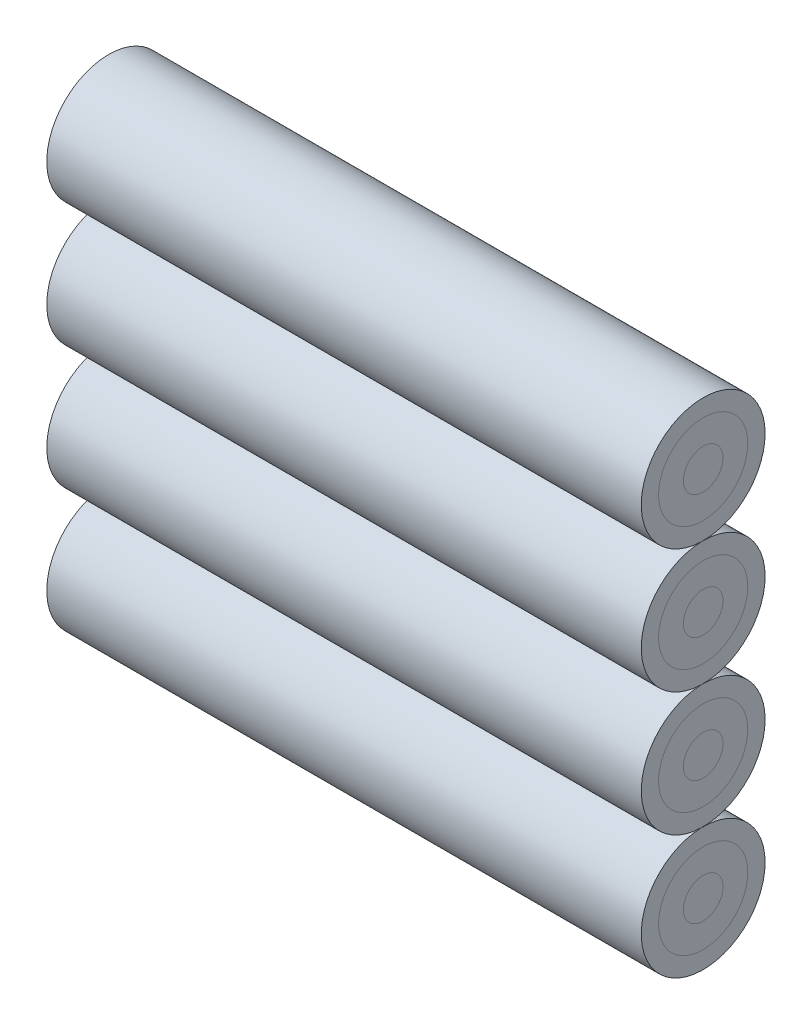
from build123d import *

# Parameters (mm, degrees)
SKETCH_1_R          = 125
EXTRUDE_1_DEPTH     = 1200
EXTRUDE_1_2_DEPTH   = 1200
EXTRUDE_1_3_DEPTH   = 1200
EXTRUDE_1_4_DEPTH   = 1200
SKETCH_2_R          = 90
CUT_EXTRUDE_1_DEPTH = 1306.995788661
SKETCH_3_R          = 90
EXTRUDE_3_DEPTH     = 1200
EXTRUDE_3_2_DEPTH   = 1200
EXTRUDE_3_3_DEPTH   = 1200
EXTRUDE_3_4_DEPTH   = 1200
SKETCH_4_R          = 40
CUT_EXTRUDE_2_DEPTH = 1306.995788661
SKETCH_5_R          = 40
EXTRUDE_7_DEPTH     = 1200
EXTRUDE_7_2_DEPTH   = 1200
EXTRUDE_7_3_DEPTH   = 1200
EXTRUDE_7_4_DEPTH   = 1200


with BuildPart() as part:
    # 草图1 → 凸台-拉伸1 (new body)
    with BuildSketch(Plane(origin=(0, 0, 0), x_dir=(0, 0, -1), z_dir=(1, 0, 0))):
        with Locations((0, 375)):
            Circle(SKETCH_1_R)
    extrude(amount=EXTRUDE_1_DEPTH)


with BuildPart() as body_2:
    # 草图1 → Extrude 1 2 (new body)
    with BuildSketch(Plane(origin=(0, 0, 0), x_dir=(0, 0, -1), z_dir=(1, 0, 0))):
        with Locations((0, -375)):
            Circle(SKETCH_1_R)
    extrude(amount=EXTRUDE_1_2_DEPTH)


with BuildPart() as body_3:
    # 草图1 → Extrude 1 3 (new body)
    with BuildSketch(Plane(origin=(0, 0, 0), x_dir=(0, 0, -1), z_dir=(1, 0, 0))):
        with BuildLine():
            ThreePointArc((-2.83e-07, -250), (125, -124.999999913), (-4.57e-07, 0))
            ThreePointArc((-4.57e-07, 0), (-125, -125.000000087), (-2.83e-07, -250))
        make_face()
    extrude(amount=EXTRUDE_1_3_DEPTH)


with BuildPart() as body_4:
    # 草图1 → Extrude 1 4 (new body)
    with BuildSketch(Plane(origin=(0, 0, 0), x_dir=(0, 0, -1), z_dir=(1, 0, 0))):
        with BuildLine():
            ThreePointArc((-4.57e-07, 0), (125, 124.999999913), (-2.83e-07, 250))
            ThreePointArc((-2.83e-07, 250), (-125, 125.000000087), (-4.57e-07, 0))
        make_face()
    extrude(amount=EXTRUDE_1_4_DEPTH)


with BuildPart() as cut_extrude_1_tool:
    # 草图2 → 切除-拉伸1 (new, through all)
    with BuildSketch(Plane(origin=(1200, 0, 0), x_dir=(0, 0, -1), z_dir=(1, 0, 0))):
        with Locations((0, 375)):
            Circle(SKETCH_2_R)
        with Locations((0, 125)):
            Circle(SKETCH_2_R)
        with Locations((0, -125)):
            Circle(SKETCH_2_R)
        with Locations((0, -375)):
            Circle(SKETCH_2_R)
    extrude(amount=-CUT_EXTRUDE_1_DEPTH)


with BuildPart() as part_1:
    add(part.part)

    # 切除-拉伸1: cut by cut_extrude_1_tool
    add(cut_extrude_1_tool.part, mode=Mode.SUBTRACT)


with BuildPart() as body_2_1:
    add(body_2.part)

    # 切除-拉伸1: cut by cut_extrude_1_tool
    add(cut_extrude_1_tool.part, mode=Mode.SUBTRACT)


with BuildPart() as body_3_1:
    add(body_3.part)

    # 切除-拉伸1: cut by cut_extrude_1_tool
    add(cut_extrude_1_tool.part, mode=Mode.SUBTRACT)


with BuildPart() as body_4_1:
    add(body_4.part)

    # 切除-拉伸1: cut by cut_extrude_1_tool
    add(cut_extrude_1_tool.part, mode=Mode.SUBTRACT)


with BuildPart() as body_5:
    # 草图3 → 凸台-拉伸3 (new body)
    with BuildSketch(Plane(origin=(0, 0, 0), x_dir=(0, 0, -1), z_dir=(1, 0, 0))):
        with Locations((0, 375)):
            Circle(SKETCH_3_R)
    extrude(amount=EXTRUDE_3_DEPTH)


with BuildPart() as body_6:
    # 草图3 → Extrude 3 2 (new body)
    with BuildSketch(Plane(origin=(0, 0, 0), x_dir=(0, 0, -1), z_dir=(1, 0, 0))):
        with Locations((0, 125)):
            Circle(SKETCH_3_R)
    extrude(amount=EXTRUDE_3_2_DEPTH)


with BuildPart() as body_7:
    # 草图3 → Extrude 3 3 (new body)
    with BuildSketch(Plane(origin=(0, 0, 0), x_dir=(0, 0, -1), z_dir=(1, 0, 0))):
        with Locations((0, -125)):
            Circle(SKETCH_3_R)
    extrude(amount=EXTRUDE_3_3_DEPTH)


with BuildPart() as body_8:
    # 草图3 → Extrude 3 4 (new body)
    with BuildSketch(Plane(origin=(0, 0, 0), x_dir=(0, 0, -1), z_dir=(1, 0, 0))):
        with Locations((0, -375)):
            Circle(SKETCH_3_R)
    extrude(amount=EXTRUDE_3_4_DEPTH)


with BuildPart() as cut_extrude_2_tool:
    # 草图4 → 切除-拉伸2 (new, through all)
    with BuildSketch(Plane(origin=(1200, 0, 0), x_dir=(0, 0, -1), z_dir=(1, 0, 0))):
        with Locations((0, 375)):
            Circle(SKETCH_4_R)
        with Locations((0, 125)):
            Circle(SKETCH_4_R)
        with Locations((0, -125)):
            Circle(SKETCH_4_R)
        with Locations((0, -375)):
            Circle(SKETCH_4_R)
    extrude(amount=-CUT_EXTRUDE_2_DEPTH)


with BuildPart() as body_5_1:
    add(body_5.part)

    # 切除-拉伸2: cut by cut_extrude_2_tool
    add(cut_extrude_2_tool.part, mode=Mode.SUBTRACT)


with BuildPart() as body_6_1:
    add(body_6.part)

    # 切除-拉伸2: cut by cut_extrude_2_tool
    add(cut_extrude_2_tool.part, mode=Mode.SUBTRACT)


with BuildPart() as body_7_1:
    add(body_7.part)

    # 切除-拉伸2: cut by cut_extrude_2_tool
    add(cut_extrude_2_tool.part, mode=Mode.SUBTRACT)


with BuildPart() as body_8_1:
    add(body_8.part)

    # 切除-拉伸2: cut by cut_extrude_2_tool
    add(cut_extrude_2_tool.part, mode=Mode.SUBTRACT)


with BuildPart() as body_9:
    # 草图5 → 凸台-拉伸7 (new body)
    with BuildSketch(Plane(origin=(0, 0, 0), x_dir=(0, 0, -1), z_dir=(1, 0, 0))):
        with Locations((0, 375)):
            Circle(SKETCH_5_R)
    extrude(amount=EXTRUDE_7_DEPTH)


with BuildPart() as body_10:
    # 草图5 → Extrude 7 2 (new body)
    with BuildSketch(Plane(origin=(0, 0, 0), x_dir=(0, 0, -1), z_dir=(1, 0, 0))):
        with Locations((0, 125)):
            Circle(SKETCH_5_R)
    extrude(amount=EXTRUDE_7_2_DEPTH)


with BuildPart() as body_11:
    # 草图5 → Extrude 7 3 (new body)
    with BuildSketch(Plane(origin=(0, 0, 0), x_dir=(0, 0, -1), z_dir=(1, 0, 0))):
        with Locations((0, -125)):
            Circle(SKETCH_5_R)
    extrude(amount=EXTRUDE_7_3_DEPTH)


with BuildPart() as body_12:
    # 草图5 → Extrude 7 4 (new body)
    with BuildSketch(Plane(origin=(0, 0, 0), x_dir=(0, 0, -1), z_dir=(1, 0, 0))):
        with Locations((0, -375)):
            Circle(SKETCH_5_R)
    extrude(amount=EXTRUDE_7_4_DEPTH)


solid = Compound([part_1.part, body_2_1.part, body_3_1.part, body_4_1.part, body_5_1.part, body_6_1.part, body_7_1.part, body_8_1.part, body_9.part, body_10.part, body_11.part, body_12.part])
